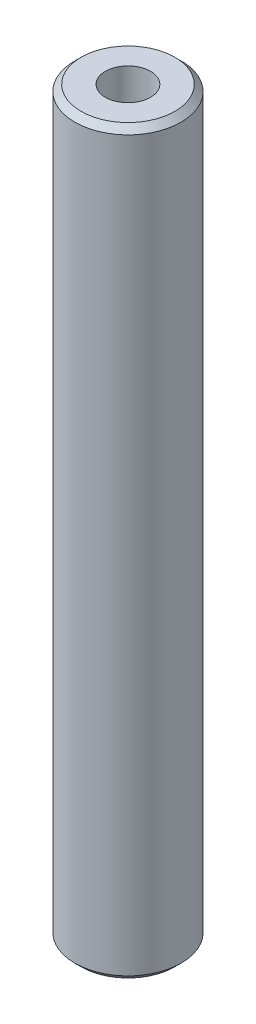
from build123d import *

# Parameters (mm, degrees)
SKETCH1_R           = 7.5
BOSS_EXTRUDE1_DEPTH = 104.535098377
SKETCH2_R           = 3.185335267
CUT_EXTRUDE1_DEPTH  = 106.071817309
CHAMFER1_SIZE       = 0.88176375


with BuildPart() as part:
    # Sketch1 → Boss-Extrude1 (new body)
    with BuildSketch(Plane(origin=(0, 0, 0), x_dir=(1, 0, 0), z_dir=(0, 1, 0))):
        Circle(SKETCH1_R)
    extrude(amount=BOSS_EXTRUDE1_DEPTH)

    # Sketch2 → Cut-Extrude1 (cut, through all)
    with BuildSketch(Plane(origin=(0, 0, 0), x_dir=(1, 0, 0), z_dir=(0, 1, 0))):
        Circle(SKETCH2_R)
    extrude(amount=CUT_EXTRUDE1_DEPTH, mode=Mode.SUBTRACT)

    # Chamfer1
    chamfer1_edges = [part.edges().sort_by_distance(p)[0] for p in [
        (-7.5, 104.535098377, 0),
        (-7.5, 0, 0),
    ]]
    chamfer(chamfer1_edges, length=CHAMFER1_SIZE)


solid = part.part
